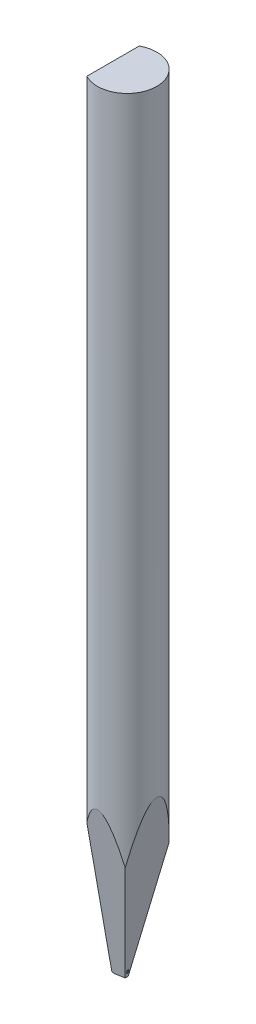
from build123d import *

# Parameters (mm, degrees)
TD_SKETCH_R                             = 0.79248
TL_FEATURE_DEPTH                        = 21.0312
TDF_STD_SKETCH_W                        = 2.09296
TDF_STD_SKETCH_H                        = 2.09296
TDF_STD_FEATURE_DEPTH                   = 22.061040395
ISA_20_STD_FEATURE_DEPTH                = 22.061040395
ISA_20_STD_FEATURE_DEPTH_BACK           = 22.061040395
F_10BA_STD_FEATURE_DEPTH                = 22.061040395
F_10BA_STD_FEATURE_DEPTH_BACK           = 22.061040395
FRO_STD_FEATURE_DEPTH                   = 22.061040395
FRO_STD_FEATURE_DEPTH_BACK              = 22.061040395
C_STD_FEATURE_DEPTH                     = 22.061040395
C_STD_FEATURE_DEPTH_BACK                = 22.061040395
ERW_STD_FEATURE_DEPTH                   = 0.01905
H_STD_FEATURE_REACH                     = 22.896
H_STD_SKETCH_R                          = 0.01905
H_STD_SKETCH_3_R                        = 0.01905
FUNNEL_FINAL_DIAMETRE_STD_FEATURE_DEPTH = 2.499995
FUNNEL_FINAL_DIAMETRE_STD_FEATURE_DRAFT = -22.5
ROUND_BR_STD_FEATURE_START              = -1
ROUND_BR_STD_FEATURE_DEPTH              = 1.009339363


with BuildPart() as part:
    # TD_sketch → TL_feature (new body)
    with BuildSketch(Plane(origin=(0, 0, 0), x_dir=(1, 0, 0), z_dir=(0, 1, 0))):
        with Locations(Location((0, 0, 0), (0, 0, 270))):
            Circle(TD_SKETCH_R)
    extrude(amount=TL_FEATURE_DEPTH)

    # TDF_STD_sketch → TDF_STD_feature (cut, through all)
    with BuildSketch(Plane(origin=(0, 0, 0), x_dir=(1, 0, 0), z_dir=(0, 1, 0))):
        with Locations((-1.4224, 0)):
            Rectangle(TDF_STD_SKETCH_W, TDF_STD_SKETCH_H)
    extrude(amount=TDF_STD_FEATURE_DEPTH, mode=Mode.SUBTRACT)

    # ISA_20_STD_sketch → ISA_20_STD_feature (cut, two sides: drawn at the far end of the back side and taken through both)
    with BuildSketch(Plane(origin=(0, 0, 0), x_dir=(0, 0, -1), z_dir=(1, 0, 0)).offset(-ISA_20_STD_FEATURE_DEPTH_BACK)):
        Polygon((-12.946999885, 73.253224398), (-3.738847997, 21.0312), (-0.03048, 0), (0.03048, 0), (3.738847997, 21.0312), (12.946999885, 73.253224398), (12.946999885, -32.802042202), (-12.946999885, -32.802042202), align=None)
    extrude(amount=ISA_20_STD_FEATURE_DEPTH + ISA_20_STD_FEATURE_DEPTH_BACK, mode=Mode.SUBTRACT)

    # 10BA_STD_sketch → 10BA_STD_feature (cut, two sides: drawn at the far end of the back side and taken through both)
    with BuildSketch(Plane.XY.offset(-F_10BA_STD_FEATURE_DEPTH_BACK)):
        Polygon((-53.216424634, 0), (-0.37592, 0), (-0.29972, 0), (-0.011354365, 0.050846642), (3.688047997, 21.0312), (12.863705333, 73.068938636), (91.245889802, 2.18375769), (25.165759835, -70.885180946), align=None)
    extrude(amount=F_10BA_STD_FEATURE_DEPTH + F_10BA_STD_FEATURE_DEPTH_BACK, mode=Mode.SUBTRACT)

    # FRO_STD_sketch → FRO_STD_feature (cut, two sides: drawn at the far end of the back side and taken through both)
    with BuildSketch(Plane.XY.offset(-FRO_STD_FEATURE_DEPTH_BACK)):
        with BuildLine():
            Line((-0.37592, 52.152138388), (-0.37592, 0.02794))
            ThreePointArc((-0.37592, 0.02794), (-0.367736563, 0.008183437), (-0.34798, 0))
            Line((-0.34798, 0), (51.776218388, 0))
            Line((51.776218388, 0), (-21.9385299, -73.714748288))
            Line((-21.9385299, -73.714748288), (-74.090668288, -21.5626099))
            Line((-74.090668288, -21.5626099), (-0.37592, 52.152138388))
        make_face()
    extrude(amount=FRO_STD_FEATURE_DEPTH + FRO_STD_FEATURE_DEPTH_BACK, mode=Mode.SUBTRACT)

    # C_STD_sketch → C_STD_feature (cut, two sides: drawn at the far end of the back side and taken through both)
    with BuildSketch(Plane(origin=(0, 0, 0), x_dir=(0, 0, -1), z_dir=(1, 0, 0)).offset(-C_STD_FEATURE_DEPTH_BACK)):
        with BuildLine():
            Line((-50.530423385, -12.791040855), (-0.030559272, 0))
            ThreePointArc((-0.030559272, 0), (0, 0.00381), (0.030559272, 0))
            Line((0.030559272, 0), (50.530423385, -12.791040855))
            Line((50.530423385, -12.791040855), (50.530423385, -116.980234183))
            Line((50.530423385, -116.980234183), (-50.530423385, -116.980234183))
            Line((-50.530423385, -116.980234183), (-50.530423385, -12.791040855))
        make_face()
    extrude(amount=C_STD_FEATURE_DEPTH + C_STD_FEATURE_DEPTH_BACK, mode=Mode.SUBTRACT)


with BuildPart() as body_2:
    # ERW_STD_sketch → ERW_STD_feature (new, symmetric)
    with BuildSketch(Plane.XY):
        Polygon((-0.1397, 0.09144), (-0.1397, 0), (-0.32512, 0), (-0.272327091, 0.09144), align=None)
    extrude(amount=ERW_STD_FEATURE_DEPTH, both=True)

    # H_STD_sketch → H_STD_feature (add, up to next)
    with BuildSketch(Plane(origin=(-0.010897713, 0.165804035, 0), x_dir=(0, 0, -1), z_dir=(0.8660254037844415, 0.4999999999999953, 0)), mode=Mode.PRIVATE) as h_std_feature_sk1:
        with Locations(Location((0, 0, 0), (0, 0, 90))):
            Circle(H_STD_SKETCH_R)
    h_std_feature_tool1 = extrude(h_std_feature_sk1.sketch, amount=-H_STD_FEATURE_REACH, mode=Mode.PRIVATE) - body_2.part
    add(h_std_feature_tool1.solids().sort_by_distance((-0.010898, 0.165804, 0))[0])


with BuildPart() as funnel_final_diametre_std_feature_tool:
    # H_STD_sketch<3> → funnel_final_diametre_STD_feature (with draft: the straight prism first)
    with BuildSketch(Plane(origin=(-0.010897713, 0.165804035, 0), x_dir=(0, 0, -1), z_dir=(0.8660254037844415, 0.4999999999999953, 0))):
        with Locations(Location((0, 0, 0), (0, 0, 90))):
            Circle(H_STD_SKETCH_3_R)
    extrude(amount=FUNNEL_FINAL_DIAMETRE_STD_FEATURE_DEPTH)
    # funnel_final_diametre_STD_feature: the draft: its side faces are tilted about the plane it starts from
    funnel_final_diametre_std_feature_sides = [funnel_final_diametre_std_feature_tool.faces().sort_by_distance(p)[0] for p in [
        (1.081156877, 0.774305001, 0),
    ]]
    draft(funnel_final_diametre_std_feature_sides, Plane(origin=(-0.010897713, 0.165804035, 0), x_dir=(0, 0, -1), z_dir=(0.8660254037844415, 0.4999999999999953, 0)), FUNNEL_FINAL_DIAMETRE_STD_FEATURE_DRAFT)


with BuildPart() as body_2_1:
    add(body_2.part)

    # funnel_final_diametre_STD_feature: add funnel_final_diametre_std_feature_tool
    add(funnel_final_diametre_std_feature_tool.part)

    # ROUND_BR_STD_feature: read off the stored shape, not the designer's step
    # ROUND_BR_STD_feature outline → ROUND_BR_STD_feature (cut)
    with BuildSketch(Plane(origin=(0, 0, 0), x_dir=(0.8660254037844362, -0.5000000000000042, 0), z_dir=(0.5000000000000042, 0.8660254037844363, 0)).offset(ROUND_BR_STD_FEATURE_START)):
        with BuildLine():
            Line((-0.281562179, -0.01905), (-0.262512179, -0.01905))
            ThreePointArc((-0.262512179, -0.01905), (-0.275982563, -0.013470384), (-0.281562179, 0))
            Line((-0.281562179, 0), (-0.281562179, -0.01905))
        make_face()
        with BuildLine():
            Line((-0.281562179, 0.01905), (-0.281562179, 0))
            ThreePointArc((-0.281562179, 0), (-0.275982563, 0.013470384), (-0.262512179, 0.01905))
            Line((-0.262512179, 0.01905), (-0.281562179, 0.01905))
        make_face()
    extrude(amount=ROUND_BR_STD_FEATURE_DEPTH, mode=Mode.SUBTRACT)


with BuildPart() as part_1:
    add(part.part)

    # COMBINE_STD_feature: cut body 2
    add(body_2_1.part, mode=Mode.SUBTRACT)


solid = part_1.part
